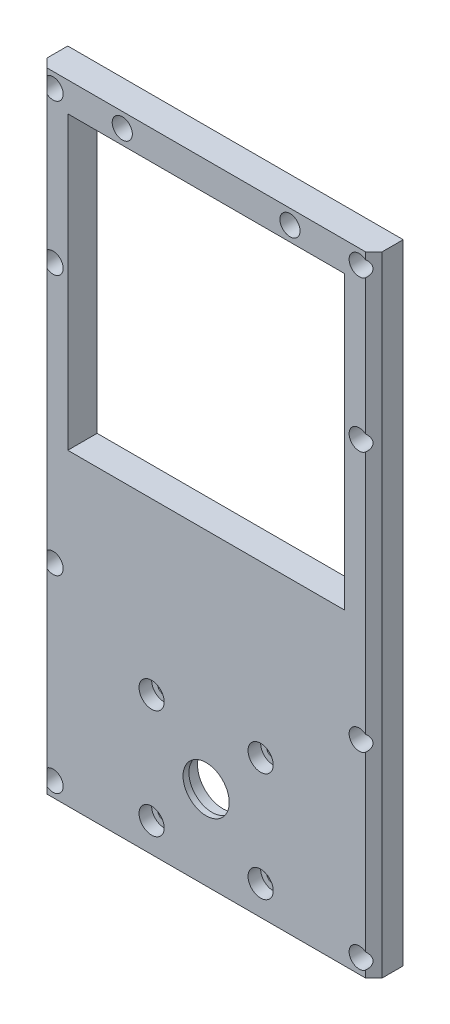
from build123d import *

# Parameters (mm, degrees)
SKETCH1_W           = 80
SKETCH1_H           = 150
SKETCH1_W_2         = 66
SKETCH1_H_2         = 136
BOSS_EXTRUDE1_DEPTH = 7
SKETCH2_W           = 66
SKETCH2_H           = 36
BOSS_EXTRUDE2_DEPTH = 7
SKETCH3_R           = 5.5
CUT_EXTRUDE1_DEPTH  = 86.287748241
SKETCH4_R           = 6.05
CUT_EXTRUDE2_DEPTH  = 5.6
SKETCH5_R           = 11
CUT_EXTRUDE3_DEPTH  = 3
SKETCH6_R           = 1.6
CUT_EXTRUDE4_DEPTH  = 86.287748241
SKETCH7_W           = 50
SKETCH7_H           = 38
CUT_EXTRUDE5_DEPTH  = 1
SKETCH8_R           = 3
CUT_EXTRUDE6_DEPTH  = 3
SKETCH9_R           = 1.35
CUT_EXTRUDE7_DEPTH  = 86.287748241
SKETCH10_R          = 2.4
CUT_EXTRUDE8_DEPTH  = 5
CHAMFER1_SIZE       = 2
SKETCH11_W          = 66
SKETCH11_H          = 30.5
BOSS_EXTRUDE3_DEPTH = 7
SKETCH12_R          = 1.35
CUT_EXTRUDE9_DEPTH  = 86.287748241
SKETCH13_R          = 2.4
CUT_EXTRUDE10_DEPTH = 5


with BuildPart() as part:
    # Sketch1 → Boss-Extrude1 (new body)
    with BuildSketch(Plane.XY):
        Rectangle(SKETCH1_W, SKETCH1_H)
        Rectangle(SKETCH1_W_2, SKETCH1_H_2, mode=Mode.SUBTRACT)
    extrude(amount=BOSS_EXTRUDE1_DEPTH)

    # Sketch2 → Boss-Extrude2 (add)
    with BuildSketch(Plane.XY.offset(7)):
        with Locations((0, -50)):
            Rectangle(SKETCH2_W, SKETCH2_H)
    extrude(amount=-BOSS_EXTRUDE2_DEPTH)

    # Sketch3 → Cut-Extrude1 (cut, through all)
    with BuildSketch(Plane(origin=(0, 0, 0), x_dir=(-1, 0, 0), z_dir=(0, 0, -1))):
        with Locations((0, -55)):
            Circle(SKETCH3_R)
    extrude(amount=-CUT_EXTRUDE1_DEPTH, mode=Mode.SUBTRACT)

    # Sketch4 → Cut-Extrude2 (cut)
    with BuildSketch(Plane(origin=(0, 0, 0), x_dir=(-1, 0, 0), z_dir=(0, 0, -1))):
        with Locations((0, -55)):
            Circle(SKETCH4_R)
    extrude(amount=-CUT_EXTRUDE2_DEPTH, mode=Mode.SUBTRACT)

    # Sketch5 → Cut-Extrude3 (cut)
    with BuildSketch(Plane(origin=(0, 0, 0), x_dir=(-1, 0, 0), z_dir=(0, 0, -1))):
        with Locations((0, -55)):
            Circle(SKETCH5_R)
    extrude(amount=-CUT_EXTRUDE3_DEPTH, mode=Mode.SUBTRACT)

    # Sketch6 → Cut-Extrude4 (cut, through all)
    with BuildSketch(Plane(origin=(0, 0, 0), x_dir=(-1, 0, 0), z_dir=(0, 0, -1))):
        with Locations((-13, -42)):
            Circle(SKETCH6_R)
        with Locations((13, -42)):
            Circle(SKETCH6_R)
        with Locations((13, -68)):
            Circle(SKETCH6_R)
        with Locations((-13, -68)):
            Circle(SKETCH6_R)
    extrude(amount=-CUT_EXTRUDE4_DEPTH, mode=Mode.SUBTRACT)

    # Sketch7 → Cut-Extrude5 (cut)
    with BuildSketch(Plane(origin=(0, 0, 0), x_dir=(-1, 0, 0), z_dir=(0, 0, -1))):
        with Locations((0, -55)):
            Rectangle(SKETCH7_W, SKETCH7_H)
    extrude(amount=-CUT_EXTRUDE5_DEPTH, mode=Mode.SUBTRACT)

    # Sketch8 → Cut-Extrude6 (cut)
    with BuildSketch(Plane.XY.offset(7)):
        with Locations((-13, -42)):
            Circle(SKETCH8_R)
        with Locations((13, -42)):
            Circle(SKETCH8_R)
        with Locations((13, -68)):
            Circle(SKETCH8_R)
        with Locations((-13, -68)):
            Circle(SKETCH8_R)
    extrude(amount=-CUT_EXTRUDE6_DEPTH, mode=Mode.SUBTRACT)

    # Sketch9 → Cut-Extrude7 (cut, through all)
    with BuildSketch(Plane.XY.offset(7)):
        with Locations((-36.5, 71.5)):
            Circle(SKETCH9_R)
        with Locations((36.5, 71.5)):
            Circle(SKETCH9_R)
        with Locations((-36.5, -71.5)):
            Circle(SKETCH9_R)
        with Locations((36.5, -71.5)):
            Circle(SKETCH9_R)
        with Locations((-36.5, 35.5)):
            Circle(SKETCH9_R)
        with Locations((36.5, 35.5)):
            Circle(SKETCH9_R)
        with Locations((36.5, -26.5)):
            Circle(SKETCH9_R)
        with Locations((-36.5, -26.5)):
            Circle(SKETCH9_R)
    extrude(amount=-CUT_EXTRUDE7_DEPTH, mode=Mode.SUBTRACT)

    # Sketch10 → Cut-Extrude8 (cut)
    with BuildSketch(Plane.XY.offset(7)):
        with Locations((-36.5, 71.5)):
            Circle(SKETCH10_R)
        with Locations((36.5, 35.5)):
            Circle(SKETCH10_R)
        with Locations((-36.5, 35.5)):
            Circle(SKETCH10_R)
        with Locations((36.5, 71.5)):
            Circle(SKETCH10_R)
        with Locations((-36.5, -71.5)):
            Circle(SKETCH10_R)
        with Locations((36.5, -71.5)):
            Circle(SKETCH10_R)
        with Locations((-36.5, -26.5)):
            Circle(SKETCH10_R)
        with Locations((36.5, -26.5)):
            Circle(SKETCH10_R)
    extrude(amount=-CUT_EXTRUDE8_DEPTH, mode=Mode.SUBTRACT)

    # Chamfer1
    # the kernel refuses this chamfer: 2 mm, written as the material it takes off along each edge
    with BuildSketch(Plane(origin=(-40, 80.143365976, 7), x_dir=(-0.027495876610585623, 0, -0.9996219169112968), z_dir=(0, -1, 0)), Plane(origin=(40, -80.143365976, 7), x_dir=(0.027495876610585623, 0, -0.9996219169112968), z_dir=(0, 1, 0))) as chamfer1_piece_1:
        Polygon((CHAMFER1_SIZE * 0.999621916911, CHAMFER1_SIZE * 0.0274958766106), (-CHAMFER1_SIZE * 0.0274958766106, CHAMFER1_SIZE * 0.999621916911), (0, 0), align=None)
    extrude(amount=160.286731952, mode=Mode.SUBTRACT)

    # Sketch11 → Boss-Extrude3 (add)
    with BuildSketch(Plane.XY.offset(7)):
        with Locations((0, -16.75)):
            Rectangle(SKETCH11_W, SKETCH11_H)
    extrude(amount=-BOSS_EXTRUDE3_DEPTH)

    # Sketch12 → Cut-Extrude9 (cut, through all)
    with BuildSketch(Plane.XY.offset(7)):
        with Locations((-20, 71.5)):
            Circle(SKETCH12_R)
        with Locations((20, 71.5)):
            Circle(SKETCH12_R)
    extrude(amount=-CUT_EXTRUDE9_DEPTH, mode=Mode.SUBTRACT)

    # Sketch13 → Cut-Extrude10 (cut)
    with BuildSketch(Plane.XY.offset(7)):
        with Locations((-20, 71.5)):
            Circle(SKETCH13_R)
        with Locations((20, 71.5)):
            Circle(SKETCH13_R)
    extrude(amount=-CUT_EXTRUDE10_DEPTH, mode=Mode.SUBTRACT)


solid = part.part
